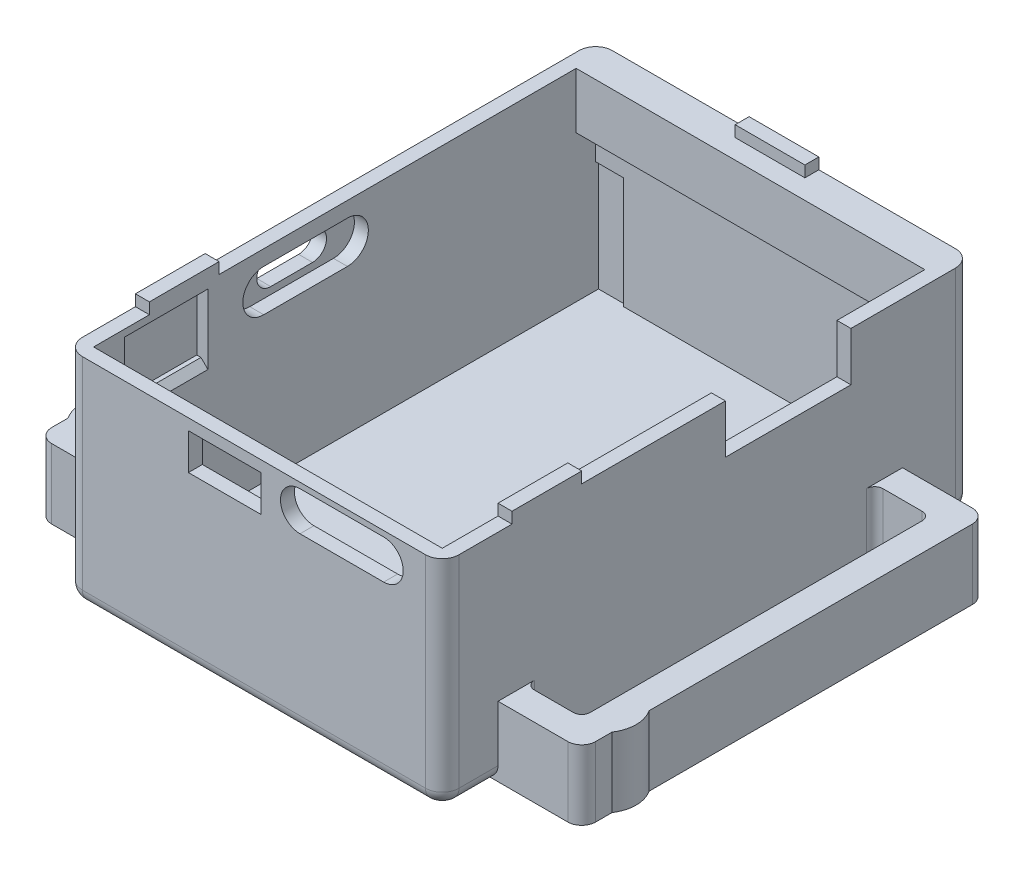
from build123d import *

# Parameters (mm, degrees)
SKETCH_1_W          = 27
SKETCH_1_H          = 38
EXTRUDE_1_DEPTH     = 1
SKETCH_3_W          = 27
SKETCH_3_H          = 38
SKETCH_3_W_2        = 25
SKETCH_3_H_2        = 36
EXTRUDE_2_DEPTH     = 14.5
FILLET_1_R          = 1.2
EXTRUDE_3_DEPTH     = 5
FILLET_3_R          = 1
FILLET_4_R          = 0.6
FILLET_6_R          = 1
CUT_EXTRUDE_1_REACH = 47.437
CUT_EXTRUDE_2_REACH = 43.113
SKETCH_6_W          = 9
SKETCH_6_H          = 3.5
EXTRUDE_4_DEPTH     = 5
CUT_EXTRUDE_3_REACH = 47.61
SKETCH_8_W          = 5.2
SKETCH_8_H          = 2.6
SKETCH_13_W         = 6
SKETCH_13_H         = 4
CUT_EXTRUDE_6_DEPTH = 0.8
SKETCH_15_W         = 25
SKETCH_15_H         = 5
EXTRUDE_5_DEPTH     = 1.4
CHAMFER_3_SIZE      = 1
SKETCH_16_W         = 2
SKETCH_16_H         = 0.2
CUT_EXTRUDE_7_DEPTH = 8
SKETCH_18_W         = 5
SKETCH_18_H         = 1
SKETCH_18_W_2       = 1
SKETCH_18_H_2       = 5
EXTRUDE_6_DEPTH     = 0.8
EXTRUDE_9_DEPTH     = 1
CUT_EXTRUDE_8_REACH = 44.545
CUT_EXTRUDE_9_DEPTH = 1
CHAMFER_4_SIZE      = 0.5
SKETCH_22_W         = 8
SKETCH_22_H         = 6
EXTRUDE_10_DEPTH    = 0.8
CHAMFER_6_SIZE      = 0.8
CHAMFER_7_SIZE      = 0.5


with BuildPart() as part:
    # 草图1 → 凸台-拉伸1 (new body)
    with BuildSketch(Plane(origin=(0, 0, 0), x_dir=(1, 0, 0), z_dir=(0, 1, 0))):
        Rectangle(SKETCH_1_W, SKETCH_1_H)
    extrude(amount=EXTRUDE_1_DEPTH)

    # 草图3 → 凸台-拉伸2 (add)
    with BuildSketch(Plane(origin=(0, 1, 0), x_dir=(1, 0, 0), z_dir=(0, 1, 0))):
        Rectangle(SKETCH_3_W, SKETCH_3_H)
        Rectangle(SKETCH_3_W_2, SKETCH_3_H_2, mode=Mode.SUBTRACT)
    extrude(amount=EXTRUDE_2_DEPTH)

    # 圆角1
    fillet_1_edges = [part.edges().sort_by_distance(p)[0] for p in [
        (13.5, 7.75, 19),
        (-13.5, 7.75, 19),
        (-13.5, 7.75, -19),
        (13.5, 7.75, -19),
    ]]
    fillet(fillet_1_edges, radius=FILLET_1_R)

    # 草图4 → 凸台-拉伸3 (add)
    with BuildSketch(Plane.XZ):
        Polygon((13.5, 15), (19.5, 15), (19.5, -14), (13.5, -14), (13.5, -12), (17.5, -12), (17.5, 13), (13.5, 13), align=None)
        Polygon((-17.5, 13), (-17.5, -12), (-13.5, -12), (-13.5, -14), (-19.5, -14), (-19.5, 15), (-13.5, 15), (-13.5, 13), align=None)
    extrude(amount=-EXTRUDE_3_DEPTH)

    # 圆角3
    fillet_3_edges = [part.edges().sort_by_distance(p)[0] for p in [
        (19.5, 2.5, 15),
        (19.5, 2.5, -14),
        (-19.5, 2.5, -14),
        (-19.5, 2.5, 15),
    ]]
    fillet(fillet_3_edges, radius=FILLET_3_R)

    # 圆角4
    fillet_4_edges = [part.edges().sort_by_distance(p)[0] for p in [
        (13.5, 2.5, 13),
        (13.5, 2.5, -12),
        (17.5, 2.5, -12),
        (17.5, 2.5, 13),
        (-13.5, 2.5, 13),
        (-17.5, 2.5, 13),
        (-17.5, 2.5, -12),
        (-13.5, 2.5, -12),
    ]]
    fillet(fillet_4_edges, radius=FILLET_4_R)

    # 圆角6
    fillet_6_edges = [part.edges().sort_by_distance(p)[0] for p in [
        (0, 0, -19),
        (13.5, 0, 16.4),
        (0, 0, 19),
        (-13.5, 0, -15.9),
        (13.148528137, 0, 18.648528137),
        (-13.148528137, 0, 18.648528137),
        (-13.148528137, 0, -18.648528137),
        (13.148528137, 0, -18.648528137),
        (13.5, 0, -15.9),
        (-13.5, 0, 16.4),
    ]]
    fillet(fillet_6_edges, radius=FILLET_6_R)

    # 草图5 → 切除-拉伸1 (cut, up to next)
    with BuildSketch(Plane.XY.offset(19), mode=Mode.PRIVATE) as cut_extrude_1_sk1:
        with BuildLine():
            Line((3.3, 15.1), (9.3, 15.1))
            ThreePointArc((9.3, 15.1), (10.7, 13.7), (9.3, 12.3))
            Line((9.3, 12.3), (3.3, 12.3))
            ThreePointArc((3.3, 12.3), (1.9, 13.7), (3.3, 15.1))
        make_face()
    cut_extrude_1_tool1 = extrude(cut_extrude_1_sk1.sketch, amount=-CUT_EXTRUDE_1_REACH, mode=Mode.PRIVATE) & part.part
    add(cut_extrude_1_tool1.solids().sort_by_distance((6.3, 13.7, 19))[0], mode=Mode.SUBTRACT)

    # 草图6 → 切除-拉伸2 (cut, up to next)
    with BuildSketch(Plane(origin=(13.5, 0, 0), x_dir=(0, 0, -1), z_dir=(1, 0, 0)), mode=Mode.PRIVATE) as cut_extrude_2_sk1:
        with Locations((5.8, 13.75)):
            Rectangle(SKETCH_6_W, SKETCH_6_H)
    cut_extrude_2_tool1 = extrude(cut_extrude_2_sk1.sketch, amount=-CUT_EXTRUDE_2_REACH, mode=Mode.PRIVATE) & part.part
    add(cut_extrude_2_tool1.solids().sort_by_distance((13.5, 13.75, -5.8))[0], mode=Mode.SUBTRACT)

    # 草图7 → 凸台-拉伸4 (add)
    with BuildSketch(Plane.XZ):
        with BuildLine():
            Line((19.5, 12.826649916), (19.5, 10.173350084))
            ThreePointArc((19.5, 10.173350084), (19.9, 11.5), (19.5, 12.826649916))
        make_face()
        with BuildLine():
            Line((-19.5, 12.826649916), (-19.5, 10.173350084))
            ThreePointArc((-19.5, 10.173350084), (-19.9, 11.5), (-19.5, 12.826649916))
        make_face()
    extrude(amount=-EXTRUDE_4_DEPTH)

    # 草图8 → 切除-拉伸3 (cut, up to next)
    with BuildSketch(Plane.XY.offset(19), mode=Mode.PRIVATE) as cut_extrude_3_sk1:
        with Locations((-2.1, 13.4)):
            Rectangle(SKETCH_8_W, SKETCH_8_H)
    cut_extrude_3_tool1 = extrude(cut_extrude_3_sk1.sketch, amount=-CUT_EXTRUDE_3_REACH, mode=Mode.PRIVATE) & part.part
    add(cut_extrude_3_tool1.solids().sort_by_distance((-2.1, 13.4, 19))[0], mode=Mode.SUBTRACT)

    # 草图13 → 切除-拉伸6 (cut)
    with BuildSketch(Plane(origin=(-12.5, 0, 0), x_dir=(0, 0, -1), z_dir=(1, 0, 0))):
        with Locations((-12.8, 12.5)):
            Rectangle(SKETCH_13_W, SKETCH_13_H)
    extrude(amount=-CUT_EXTRUDE_6_DEPTH, mode=Mode.SUBTRACT)

    # 草图15 → 凸台-拉伸5 (add)
    with BuildSketch(Plane.XY.offset(-18)):
        with Locations((0, 13)):
            Rectangle(SKETCH_15_W, SKETCH_15_H)
    extrude(amount=EXTRUDE_5_DEPTH)

    # 倒角3
    chamfer_3_edges = [part.edges().sort_by_distance(p)[0] for p in [
        (0, 10.5, -16.6),
    ]]
    chamfer(chamfer_3_edges, length=CHAMFER_3_SIZE)

    # 草图16 → 切除-拉伸7 (cut)
    with BuildSketch(Plane(origin=(0, 1, 0), x_dir=(1, 0, 0), z_dir=(0, 1, 0))):
        with Locations((-11.5, 18.1)):
            Rectangle(SKETCH_16_W, SKETCH_16_H)
        with Locations((11.1, 18.1)):
            Rectangle(SKETCH_16_W, SKETCH_16_H)
    extrude(amount=CUT_EXTRUDE_7_DEPTH, mode=Mode.SUBTRACT)

    # 草图18 → 凸台-拉伸6 (add)
    with BuildSketch(Plane(origin=(0, 15.5, 0), x_dir=(1, 0, 0), z_dir=(0, 1, 0))):
        with Locations((0, 18.5)):
            Rectangle(SKETCH_18_W, SKETCH_18_H)
        with Locations((-13, -11.5)):
            Rectangle(SKETCH_18_W_2, SKETCH_18_H_2)
        with Locations((13, -11.5)):
            Rectangle(SKETCH_18_W_2, SKETCH_18_H_2)
    extrude(amount=EXTRUDE_6_DEPTH)

    # 草图19 → 凸台-拉伸9 (add)
    with BuildSketch(Plane.ZY.offset(13.5)):
        with BuildLine():
            Line((-0.2, 14.9), (5.8, 14.9))
            ThreePointArc((5.8, 14.9), (7.8, 12.9), (5.8, 10.9))
            Line((5.8, 10.9), (-0.2, 10.9))
            ThreePointArc((-0.2, 10.9), (-2.2, 12.9), (-0.2, 14.9))
        make_face()
    extrude(amount=EXTRUDE_9_DEPTH)

    # 草图20 → 切除-拉伸8 (cut, up to next)
    with BuildSketch(Plane.ZY.offset(14.5), mode=Mode.PRIVATE) as cut_extrude_8_sk1:
        with BuildLine():
            Line((1.3, 13.9), (4.3, 13.9))
            ThreePointArc((4.3, 13.9), (5.3, 12.9), (4.3, 11.9))
            Line((4.3, 11.9), (1.3, 11.9))
            ThreePointArc((1.3, 11.9), (0.3, 12.9), (1.3, 13.9))
        make_face()
    cut_extrude_8_tool1 = extrude(cut_extrude_8_sk1.sketch, amount=-CUT_EXTRUDE_8_REACH, mode=Mode.PRIVATE) & part.part
    add(cut_extrude_8_tool1.solids().sort_by_distance((-14.5, 12.9, 2.8))[0], mode=Mode.SUBTRACT)

    # 草图21 → 切除-拉伸9 (cut)
    with BuildSketch(Plane(origin=(-12.5, 0, 0), x_dir=(0, 0, -1), z_dir=(1, 0, 0))):
        with BuildLine():
            Line((-5.8, 14.4), (0.2, 14.4))
            ThreePointArc((0.2, 14.4), (1.7, 12.9), (0.2, 11.4))
            Line((0.2, 11.4), (-5.8, 11.4))
            ThreePointArc((-5.8, 11.4), (-7.3, 12.9), (-5.8, 14.4))
        make_face()
    extrude(amount=-CUT_EXTRUDE_9_DEPTH, mode=Mode.SUBTRACT)

    # 倒角4
    chamfer_4_edges = [part.edges().sort_by_distance(p)[0] for p in [
        (-14.5, 12.9, -2.2),
        (-14.5, 10.9, 2.8),
        (-14.5, 12.9, 7.8),
        (-14.5, 14.9, 2.8),
    ]]
    chamfer(chamfer_4_edges, length=CHAMFER_4_SIZE)

    # 草图22 → 凸台-拉伸10 (add)
    with BuildSketch(Plane.ZY.offset(13.5)):
        with Locations((12.8, 12.5)):
            Rectangle(SKETCH_22_W, SKETCH_22_H)
    extrude(amount=EXTRUDE_10_DEPTH)

    # 倒角6
    chamfer_6_edges = [part.edges().sort_by_distance(p)[0] for p in [
        (-14.3, 12.5, 16.8),
        (-14.3, 9.5, 12.8),
        (-14.3, 15.5, 12.8),
        (-14.3, 12.5, 8.8),
    ]]
    chamfer(chamfer_6_edges, length=CHAMFER_6_SIZE - 0.0001)  # a hair under: the kernel refuses the full size

    # 倒角7
    chamfer_7_edges = [part.edges().sort_by_distance(p)[0] for p in [
        (-12.5, 10.5, 12.8),
        (-12.5, 14.5, 12.8),
    ]]
    chamfer(chamfer_7_edges, length=CHAMFER_7_SIZE)


solid = part.part
